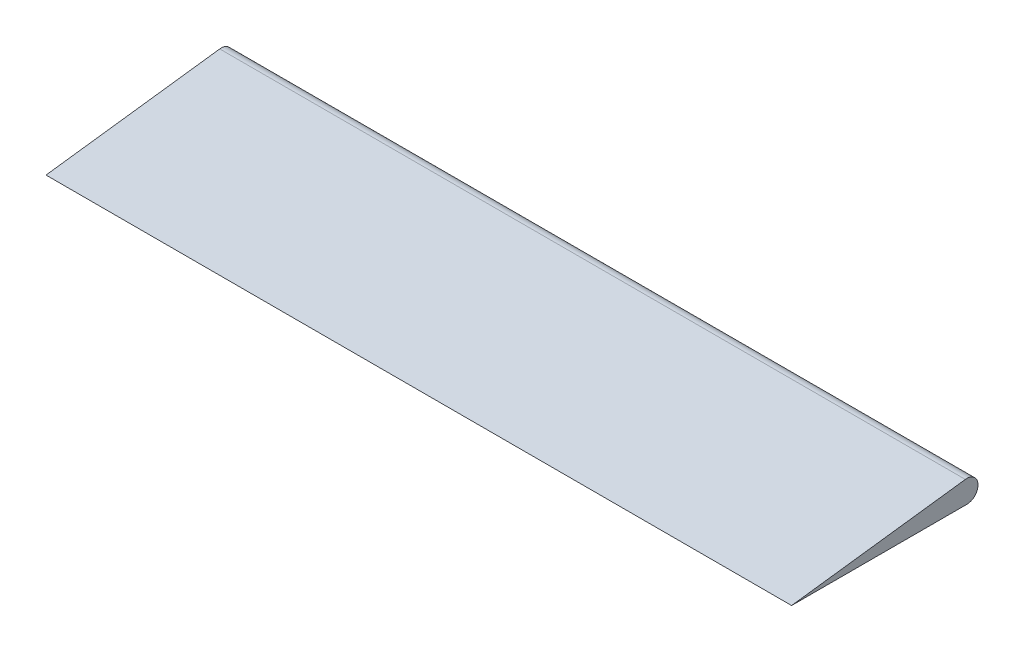
from build123d import *

# Parameters (mm, degrees)
BOSS_EXTRUDE1_DEPTH = 1000


with BuildPart() as part:
    # Sketch1 → Boss-Extrude1 (new body)
    with BuildSketch(Plane(origin=(0, 0, 0), x_dir=(0, 0, -1), z_dir=(1, 0, 0))):
        with BuildLine():
            Line((0, 0), (234.938350651, 0))
            ThreePointArc((234.938350651, 0), (249.969143719, 16.025257606), (233.015082359, 30))
            Line((233.015082359, 30), (0, 0))
        make_face()
    extrude(amount=BOSS_EXTRUDE1_DEPTH)


solid = part.part
